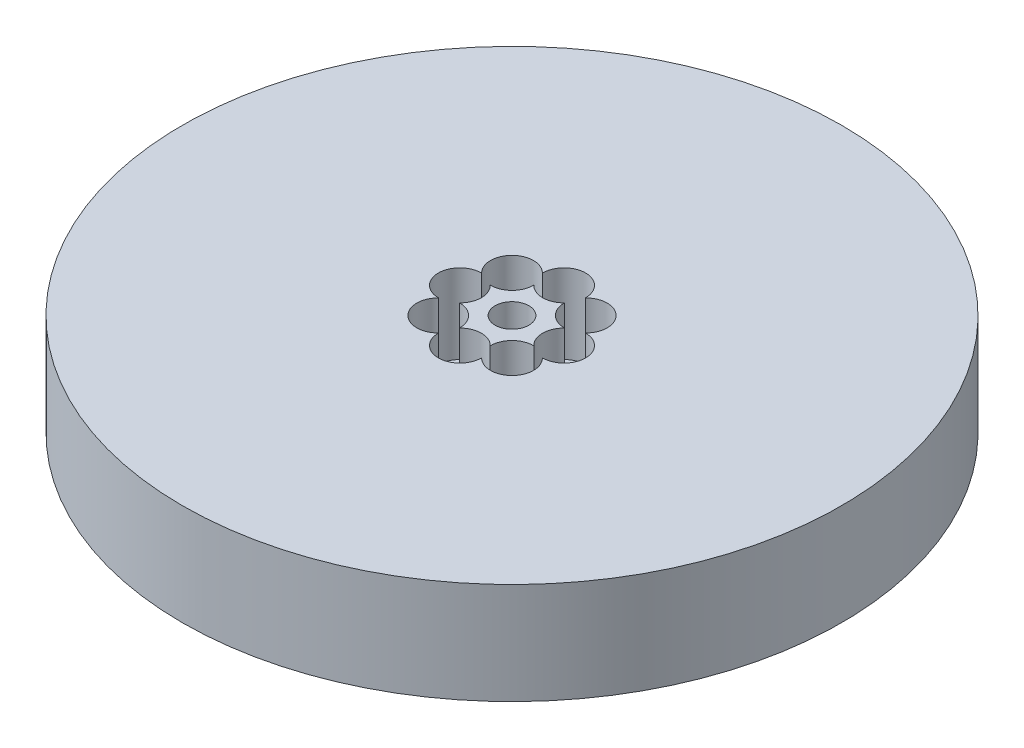
from build123d import *

# Parameters (mm, degrees)
SKETCH1_R           = 97.5
BOSS_EXTRUDE1_DEPTH = 30
SKETCH2_R           = 5
CUT_EXTRUDE1_DEPTH  = 142.111657917
SKETCH3_R           = 6.357711216
CUT_EXTRUDE2_DEPTH  = 23.505333603
CIRPATTERN1_COUNT   = 8


with BuildPart() as part:
    # Sketch1 → Boss-Extrude1 (new body)
    with BuildSketch(Plane(origin=(0, 0, 0), x_dir=(1, 0, 0), z_dir=(0, 1, 0))):
        Circle(SKETCH1_R)
    extrude(amount=BOSS_EXTRUDE1_DEPTH)

    # Sketch2 → Cut-Extrude1 (cut, through all)
    with BuildSketch(Plane(origin=(0, 0, 0), x_dir=(1, 0, 0), z_dir=(0, 1, 0))):
        Circle(SKETCH2_R)
    extrude(amount=CUT_EXTRUDE1_DEPTH, mode=Mode.SUBTRACT)

    # Sketch3 → Cut-Extrude2 (cut)
    with BuildSketch(Plane(origin=(0, 30, 0), x_dir=(1, 0, 0), z_dir=(0, 1, 0))):
        with Locations((-15.425910616, 0)):
            Circle(SKETCH3_R)
    cut_extrude2 = extrude(amount=-CUT_EXTRUDE2_DEPTH, mode=Mode.SUBTRACT)

    # CirPattern1: Cut-Extrude2 ×8 about axis
    cirpattern1_axis = Axis((0, 0, 0), (0, 1, 0))
    for i in range(1, CIRPATTERN1_COUNT):
        add(cut_extrude2.rotate(cirpattern1_axis, i * 360 / CIRPATTERN1_COUNT), mode=Mode.SUBTRACT)


solid = part.part
